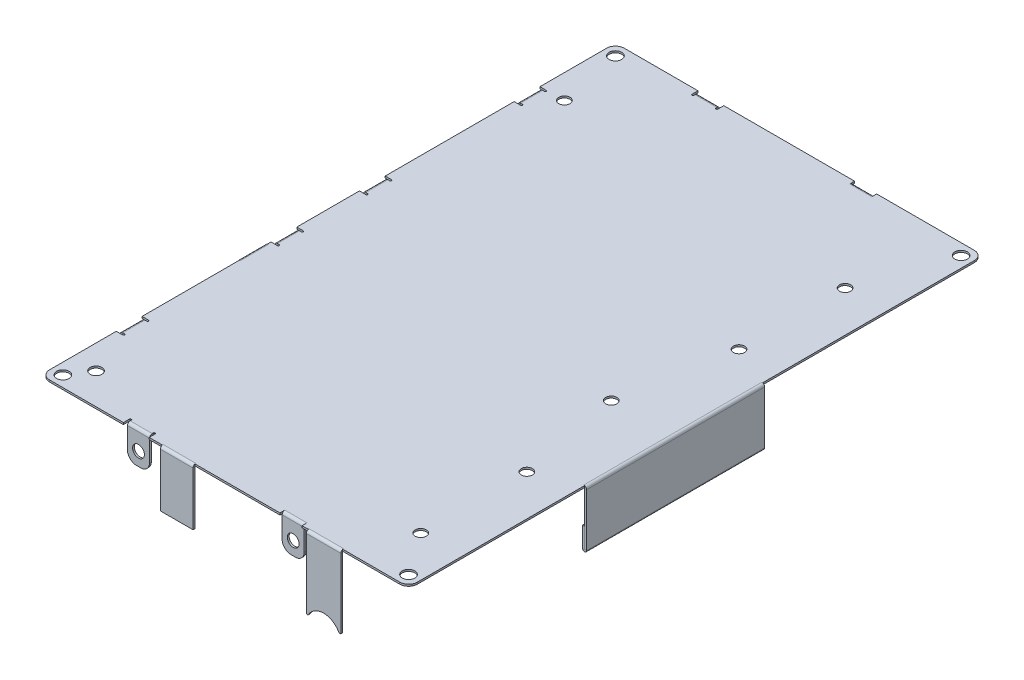
from build123d import *

# Parameters (mm, degrees)
BASE_FLANGE1_DEPTH             = 0.53
EDGE_FLANGE2_STRIP_W           = 3.257999756
EDGE_FLANGE2_STRIP_H           = 0.53
EDGE_FLANGE2_STRIP_CUT_DEPTH   = 6.35
EDGE_FLANGE2_RELIEF_W          = 3.787999756
EDGE_FLANGE2_RELIEF_H          = 0.53
EDGE_FLANGE2_RELIEF_CUT_DEPTH  = 0.53
EDGE_FLANGE2_DEPTH             = 6.35
EDGE_FLANGE2_FLAT_DEPTH        = 0.53
EDGE_FLANGE7_STRIP_W           = 3.258000001
EDGE_FLANGE7_STRIP_H           = 0.53
EDGE_FLANGE7_STRIP_CUT_DEPTH   = 6.35
EDGE_FLANGE7_DEPTH             = 6.35
EDGE_FLANGE7_FLAT_DEPTH        = 0.53
EDGE_FLANGE4_START             = -0.53
EDGE_FLANGE4_OUTLINE_W         = 7.41
EDGE_FLANGE4_OUTLINE_H         = 0.53
EDGE_FLANGE4_DEPTH             = 1.53
EDGE_FLANGE4_START_2           = -1.844
EDGE_FLANGE4_2_OUTLINE_W       = 0.53
EDGE_FLANGE4_2_OUTLINE_H       = 0.53
EDGE_FLANGE4_2_DEPTH           = 1.314
EDGE_FLANGE4_START_3           = 33.411716927
EDGE_FLANGE4_3_DEPTH           = 1.588283073
EDGE_FLANGE4_START_4           = 27.084923007
EDGE_FLANGE4_4_OUTLINE_W       = 0.53
EDGE_FLANGE4_4_OUTLINE_H       = 6.35
EDGE_FLANGE4_4_DEPTH           = 6.096
EDGE_FLANGE4_START_5           = -27.156
EDGE_FLANGE4_5_DEPTH           = 0.53
EDGE_FLANGE4_START_6           = -66.673203949
EDGE_FLANGE4_6_DEPTH           = 6.35
EDGE_FLANGE4_7_DEPTH           = 6.35
EDGE_FLANGE5_START             = -0.53
EDGE_FLANGE5_OUTLINE_W         = 7.41
EDGE_FLANGE5_OUTLINE_H         = 0.53
EDGE_FLANGE5_DEPTH             = 0.53
EDGE_FLANGE5_START_2           = -1.844
EDGE_FLANGE5_2_OUTLINE_W       = 0.53
EDGE_FLANGE5_2_OUTLINE_H       = 0.53
EDGE_FLANGE5_2_DEPTH           = 1.314
EDGE_FLANGE5_START_3           = -22.223203949
EDGE_FLANGE5_3_DEPTH           = 6.35
EDGE_FLANGE5_4_DEPTH           = 6.35
EDGE_FLANGE5_START_4           = 26.366388699
EDGE_FLANGE5_5_DEPTH           = 8.633611301
EDGE_FLANGE5_START_5           = -27.156
EDGE_FLANGE5_6_DEPTH           = 0.53
M3_CLEARANCE_HOLE2_D           = 3.4
M3_CLEARANCE_HOLE2_ON_FACE_2_D = 3.4
M3_CLEARANCE_HOLE2_ON_FACE_3_D = 3.4
M3_CLEARANCE_HOLE1_D           = 3.6
EDGE_FLANGE6_STRIP_W           = 2.628
EDGE_FLANGE6_STRIP_H           = 0.53
EDGE_FLANGE6_STRIP_CUT_DEPTH   = 51.181
EDGE_FLANGE6_DEPTH             = 51.181
HEM1_START                     = -95.438703949
HEM1_DEPTH                     = 51.181
HEM1_2_DEPTH                   = 51.181
EDGE_FLANGE8_STRIP_W           = 2.628
EDGE_FLANGE8_STRIP_H           = 0.53
EDGE_FLANGE8_STRIP_CUT_DEPTH   = 9.906
EDGE_FLANGE8_DEPTH             = 9.906
EDGE_FLANGE8_START             = 0.53
EDGE_FLANGE8_FLAT_DEPTH        = 0.53
EDGE_FLANGE9_STRIP_W           = 2.628
EDGE_FLANGE9_STRIP_H           = 0.53
EDGE_FLANGE9_STRIP_CUT_DEPTH   = 9.398
EDGE_FLANGE9_DEPTH             = 9.398
EDGE_FLANGE10_STRIP_W          = 2.628
EDGE_FLANGE10_STRIP_H          = 0.53
EDGE_FLANGE10_STRIP_CUT_DEPTH  = 8.0645
EDGE_FLANGE10_DEPTH            = 8.0645
SKETCH43_R                     = 1.6
SKETCH43_R_2                   = 1.703104565
CUT_EXTRUDE1_DEPTH             = 2.54


with BuildPart() as part:
    # Base-Flange1: sheet metal written as solids
    # Sketch1 → Base-Flange1 (new body)
    with BuildSketch(Plane(origin=(0, 33.434923007, 0), x_dir=(1, 0, 0), z_dir=(0, 1, 0))):
        with BuildLine():
            Line((-25.146, -6.350000017), (25.146, -6.350000017))
            Line((25.146, -6.350000017), (25.146, 76.198203949))
            Line((25.146, 76.198203949), (-27.686, 76.198203949))
            Line((-27.686, 76.198203949), (-27.686, -3.810000017))
            ThreePointArc((-27.686, -3.810000017), (-26.942051224, -5.606051241), (-25.146, -6.350000017))
        make_face()
    extrude(amount=BASE_FLANGE1_DEPTH)

    # Mirror2: part across plane


with BuildPart() as part_1:
    add(part.part)
    add(part.part.mirror(Plane(origin=(25.146, 33.964923007, 6.350000017), x_dir=(0, 0, 1), z_dir=(-1, 0, 0))))

    # Edge-Flange2: sheet metal written as solids
    # Edge-Flange2 strip (on a plane across the edge) → Edge-Flange2 strip cut (cut)
    with BuildSketch(Plane(origin=(2.921, 33.434923007, 5.720000261), x_dir=(0, 0, -1), z_dir=(-1, 0, 0))):
        with Locations((-0.844999878, -0.265)):
            Rectangle(EDGE_FLANGE2_STRIP_W, EDGE_FLANGE2_STRIP_H)
    extrude(amount=EDGE_FLANGE2_STRIP_CUT_DEPTH, mode=Mode.SUBTRACT)

    # Edge-Flange2 relief (on the sheet) → Edge-Flange2 relief cut (cut)
    with BuildSketch(Plane(origin=(2.921, 33.434923007, 4.936000261), x_dir=(0, 0, -1), z_dir=(0, -1, 0))):
        with Locations((-1.363999878, 0.265)):
            Rectangle(EDGE_FLANGE2_RELIEF_W, EDGE_FLANGE2_RELIEF_H)
        with Locations((-1.363999878, -6.615)):
            Rectangle(EDGE_FLANGE2_RELIEF_W, EDGE_FLANGE2_RELIEF_H)
    extrude(amount=-EDGE_FLANGE2_RELIEF_CUT_DEPTH, mode=Mode.SUBTRACT)

    # Edge-Flange2 bend section (on a plane across the edge) → Edge-Flange2 (add)
    with BuildSketch(Plane(origin=(2.921, 33.434923007, 5.720000261), x_dir=(0, 0, -1), z_dir=(-1, 0, 0))):
        with BuildLine():
            Line((0, 0.254), (0.53, 0.254))
            ThreePointArc((0.53, 0.254), (0.604394878, 0.074394878), (0.784, 0))
            Line((0.784, 0), (0.784, -0.53))
            ThreePointArc((0.784, -0.53), (0.229628284, -0.300371716), (0, 0.254))
        make_face()
    extrude(amount=EDGE_FLANGE2_DEPTH)

    # Edge-Flange2 profile (on flange) → Edge-Flange2 flat (add)
    with BuildSketch(Plane(origin=(0, 33.434923007, 5.720000261), x_dir=(-1, 0, 0), z_dir=(0, 0, 1))):
        with BuildLine():
            ThreePointArc((3.429, 6.35), (2.685051224, 8.146051224), (0.889, 8.89))
            Line((0.889, 8.89), (-0.381, 8.89))
            ThreePointArc((-0.381, 8.89), (-2.177051224, 8.146051224), (-2.921, 6.35))
            Line((-2.921, 6.35), (-2.921, 0.254))
            Line((-2.921, 0.254), (3.429, 0.254))
            Line((3.429, 0.254), (3.429, 6.35))
        make_face()
    extrude(amount=-EDGE_FLANGE2_FLAT_DEPTH)

    # Edge-Flange7: sheet metal written as solids
    # Edge-Flange7 strip (on a plane across the edge) → Edge-Flange7 strip cut (cut)
    with BuildSketch(Plane(origin=(47.371, 33.434923007, 5.720000017), x_dir=(0, 0, -1), z_dir=(-1, 0, 0))):
        with Locations((-0.845000001, -0.265)):
            Rectangle(EDGE_FLANGE7_STRIP_W, EDGE_FLANGE7_STRIP_H)
    extrude(amount=EDGE_FLANGE7_STRIP_CUT_DEPTH, mode=Mode.SUBTRACT)

    # Edge-Flange7 bend section (on a plane across the edge) → Edge-Flange7 (add)
    with BuildSketch(Plane(origin=(47.371, 33.434923007, 5.720000017), x_dir=(0, 0, -1), z_dir=(-1, 0, 0))):
        with BuildLine():
            Line((0, 0.254), (0.53, 0.254))
            ThreePointArc((0.53, 0.254), (0.604394878, 0.074394878), (0.784, 0))
            Line((0.784, 0), (0.784, -0.53))
            ThreePointArc((0.784, -0.53), (0.229628284, -0.300371716), (0, 0.254))
        make_face()
    extrude(amount=EDGE_FLANGE7_DEPTH)

    # Edge-Flange7 profile (on flange) → Edge-Flange7 flat (add)
    with BuildSketch(Plane(origin=(0, 33.434923007, 5.720000017), x_dir=(-1, 0, 0), z_dir=(0, 0, 1))):
        with BuildLine():
            Line((-41.021, 0.254), (-41.021, 6.35))
            ThreePointArc((-41.021, 6.35), (-41.764948776, 8.146051224), (-43.561, 8.89))
            Line((-43.561, 8.89), (-44.831, 8.89))
            ThreePointArc((-44.831, 8.89), (-46.627051224, 8.146051224), (-47.371, 6.35))
            Line((-47.371, 6.35), (-47.371, 0.254))
            Line((-47.371, 0.254), (-41.021, 0.254))
        make_face()
    extrude(amount=-EDGE_FLANGE7_FLAT_DEPTH)

    # Edge-Flange4: read off the stored shape, not the designer's step
    # Edge-Flange4 outline → Edge-Flange4 (cut)
    with BuildSketch(Plane(origin=(-27.686, 33.434923007, 0), x_dir=(0, 0, -1), z_dir=(-1, 0, 0)).offset(EDGE_FLANGE4_START)):
        with Locations((63.498203949, -0.265)):
            Rectangle(EDGE_FLANGE4_OUTLINE_W, EDGE_FLANGE4_OUTLINE_H)
    extrude(amount=EDGE_FLANGE4_DEPTH, mode=Mode.SUBTRACT)

    # Edge-Flange4 2 outline → Edge-Flange4 2 (cut)
    with BuildSketch(Plane(origin=(-27.686, 33.434923007, 0), x_dir=(0, 0, -1), z_dir=(-1, 0, 0)).offset(EDGE_FLANGE4_START_2)):
        with Locations((60.058203949, -0.265)):
            Rectangle(EDGE_FLANGE4_2_OUTLINE_W, EDGE_FLANGE4_2_OUTLINE_H)
        with Locations((66.938203949, -0.265)):
            Rectangle(EDGE_FLANGE4_2_OUTLINE_W, EDGE_FLANGE4_2_OUTLINE_H)
    extrude(amount=EDGE_FLANGE4_2_DEPTH, mode=Mode.SUBTRACT)

    # Edge-Flange4 3 outline → Edge-Flange4 3 (cut)
    with BuildSketch(Plane(origin=(0, 0, 0), x_dir=(1, 0, 0), z_dir=(0, 1, 0)).offset(EDGE_FLANGE4_START_3)):
        with BuildLine():
            Line((-25.842, 67.203203949), (-25.842, 66.673203949))
            ThreePointArc((-25.842, 66.673203949), (-25.577, 66.938203949), (-25.842, 67.203203949))
        make_face()
        with BuildLine():
            ThreePointArc((-25.842, 59.793203949), (-25.577, 60.058203949), (-25.842, 60.323203949))
            Line((-25.842, 60.323203949), (-25.842, 59.793203949))
        make_face()
    extrude(amount=EDGE_FLANGE4_3_DEPTH, mode=Mode.SUBTRACT)



with BuildPart() as body_2:
    # Edge-Flange4 4 outline → Edge-Flange4 4 (new body)
    with BuildSketch(Plane(origin=(0, 0, 0), x_dir=(1, 0, 0), z_dir=(0, 1, 0)).offset(EDGE_FLANGE4_START_4)):
        with Locations((-26.891, 63.498203949)):
            Rectangle(EDGE_FLANGE4_4_OUTLINE_W, EDGE_FLANGE4_4_OUTLINE_H)
    extrude(amount=EDGE_FLANGE4_4_DEPTH)

    # Edge-Flange4 5 outline → Edge-Flange4 5 (add)
    with BuildSketch(Plane.YZ.offset(EDGE_FLANGE4_START_5)):
        with BuildLine():
            Line((24.544923007, -62.863203949), (24.544923007, -64.133203949))
            ThreePointArc((24.544923007, -64.133203949), (25.288871783, -65.929255173), (27.084923007, -66.673203949))
            Line((27.084923007, -66.673203949), (27.084923007, -60.323203949))
            ThreePointArc((27.084923007, -60.323203949), (25.288871783, -61.067152725), (24.544923007, -62.863203949))
        make_face()
    extrude(amount=EDGE_FLANGE4_5_DEPTH)


with BuildPart() as part_2:
    add(part_1.part)

    add(body_2.part)  # Edge-Flange4 6 merges body 2
    # Edge-Flange4 6 outline → Edge-Flange4 6 (add)
    with BuildSketch(Plane.XY.offset(EDGE_FLANGE4_START_6)):
        with BuildLine():
            ThreePointArc((-27.11371423, 33.434923007), (-27.145356307, 33.309670906), (-27.156, 33.180923007))
            Line((-27.156, 33.180923007), (-26.626, 33.180923007))
            ThreePointArc((-26.626, 33.180923007), (-26.551605122, 33.360528129), (-26.372, 33.434923007))
            Line((-26.372, 33.434923007), (-27.11371423, 33.434923007))
        make_face()
    extrude(amount=EDGE_FLANGE4_6_DEPTH)

    # Edge-Flange4 7 outline → Edge-Flange4 7 (cut)
    with BuildSketch(Plane.XY.offset(EDGE_FLANGE4_START_6)):
        with BuildLine():
            Line((-27.156, 33.434923007), (-27.11371423, 33.434923007))
            ThreePointArc((-27.11371423, 33.434923007), (-26.827806976, 33.818807009), (-26.372, 33.964923007))
            Line((-26.372, 33.964923007), (-27.156, 33.964923007))
            Line((-27.156, 33.964923007), (-27.156, 33.434923007))
        make_face()
    extrude(amount=EDGE_FLANGE4_7_DEPTH, mode=Mode.SUBTRACT)

    # Edge-Flange5: read off the stored shape, not the designer's step
    # Edge-Flange5 outline → Edge-Flange5 (cut)
    with BuildSketch(Plane(origin=(-27.686, 33.434923007, 0), x_dir=(0, 0, -1), z_dir=(-1, 0, 0)).offset(EDGE_FLANGE5_START)):
        with Locations((19.048203949, -0.265)):
            Rectangle(EDGE_FLANGE5_OUTLINE_W, EDGE_FLANGE5_OUTLINE_H)
    extrude(amount=EDGE_FLANGE5_DEPTH, mode=Mode.SUBTRACT)

    # Edge-Flange5 2 outline → Edge-Flange5 2 (cut)
    with BuildSketch(Plane(origin=(-27.686, 33.434923007, 0), x_dir=(0, 0, -1), z_dir=(-1, 0, 0)).offset(EDGE_FLANGE5_START_2)):
        with Locations((15.608203949, -0.265)):
            Rectangle(EDGE_FLANGE5_2_OUTLINE_W, EDGE_FLANGE5_2_OUTLINE_H)
        with Locations((22.488203949, -0.265)):
            Rectangle(EDGE_FLANGE5_2_OUTLINE_W, EDGE_FLANGE5_2_OUTLINE_H)
    extrude(amount=EDGE_FLANGE5_2_DEPTH, mode=Mode.SUBTRACT)

    # Edge-Flange5 3 outline → Edge-Flange5 3 (cut)
    with BuildSketch(Plane.XY.offset(EDGE_FLANGE5_START_3)):
        with BuildLine():
            Line((-27.156, 33.434923007), (-27.11371423, 33.434923007))
            ThreePointArc((-27.11371423, 33.434923007), (-26.827806976, 33.818807009), (-26.372, 33.964923007))
            Line((-26.372, 33.964923007), (-27.156, 33.964923007))
            Line((-27.156, 33.964923007), (-27.156, 33.434923007))
        make_face()
    extrude(amount=EDGE_FLANGE5_3_DEPTH, mode=Mode.SUBTRACT)

    # Edge-Flange5 4 outline → Edge-Flange5 4 (add)
    with BuildSketch(Plane.XY.offset(EDGE_FLANGE5_START_3)):
        with BuildLine():
            Line((-27.156, 24.544923007), (-26.626, 24.544923007))
            Line((-26.626, 24.544923007), (-26.626, 33.180923007))
            ThreePointArc((-26.626, 33.180923007), (-26.551605122, 33.360528129), (-26.372, 33.434923007))
            Line((-26.372, 33.434923007), (-27.11371423, 33.434923007))
            ThreePointArc((-27.11371423, 33.434923007), (-27.145356307, 33.309670906), (-27.156, 33.180923007))
            Line((-27.156, 33.180923007), (-27.156, 24.544923007))
        make_face()
    extrude(amount=EDGE_FLANGE5_4_DEPTH)

    # Edge-Flange5 5 outline → Edge-Flange5 5 (cut)
    with BuildSketch(Plane(origin=(0, 0, 0), x_dir=(1, 0, 0), z_dir=(0, 1, 0)).offset(EDGE_FLANGE5_START_4)):
        with BuildLine():
            Line((-25.842, 22.753203949), (-25.842, 22.223203949))
            ThreePointArc((-25.842, 22.223203949), (-25.577, 22.488203949), (-25.842, 22.753203949))
        make_face()
        with BuildLine():
            Line((-25.842, 15.873203949), (-25.842, 15.343203949))
            ThreePointArc((-25.842, 15.343203949), (-25.577, 15.608203949), (-25.842, 15.873203949))
        make_face()
    extrude(amount=EDGE_FLANGE5_5_DEPTH, mode=Mode.SUBTRACT)

    # Edge-Flange5 6 outline → Edge-Flange5 6 (cut)
    with BuildSketch(Plane.YZ.offset(EDGE_FLANGE5_START_5)):
        with BuildLine():
            ThreePointArc((27.084923007, -22.223203949), (25.288871783, -21.479255173), (24.544923007, -19.683203949))
            Line((24.544923007, -19.683203949), (24.544923007, -22.223203949))
            Line((24.544923007, -22.223203949), (27.084923007, -22.223203949))
        make_face()
        with BuildLine():
            Line((24.544923007, -15.873203949), (24.544923007, -18.413203949))
            ThreePointArc((24.544923007, -18.413203949), (25.288871783, -16.617152725), (27.084923007, -15.873203949))
            Line((27.084923007, -15.873203949), (24.544923007, -15.873203949))
        make_face()
    extrude(amount=EDGE_FLANGE5_6_DEPTH, mode=Mode.SUBTRACT)

    # M3 Clearance Hole2 (through all)
    with Locations(Plane(origin=(-26.626, 28.354923007, -63.498203949), x_dir=(0, 1, 0), z_dir=(1, 0, 0))):
        with Locations((0, 0), (0, 44.45)):
            Hole(M3_CLEARANCE_HOLE2_D / 2)

    # M3 Clearance Hole2 on face 2 (through all)
    with Locations(Plane(origin=(-0.254, 28.354923007, 5.190000261), x_dir=(-1, 0, 0), z_dir=(0, 0, -1))):
        with Locations((0, 0)):
            Hole(M3_CLEARANCE_HOLE2_ON_FACE_2_D / 2)

    # M3 Clearance Hole2 on face 3 (through all)
    with Locations(Plane(origin=(44.196, 28.354923007, 5.720000017), x_dir=(1, 0, 0), z_dir=(0, 0, 1))):
        with Locations((0, 0)):
            Hole(M3_CLEARANCE_HOLE2_ON_FACE_3_D / 2)

    # M3 Clearance Hole1 (through all)
    with Locations(Plane(origin=(0, 33.964923007, 0), x_dir=(1, 0, 0), z_dir=(0, 1, 0))):
        with Locations((-24.511, -3.176796068), (74.803, -3.176796068)):
            Hole(M3_CLEARANCE_HOLE1_D / 2)

    # Mirror1: part across face


with BuildPart() as part_3:
    add(part_2.part)
    add(part_2.part.mirror(Plane(origin=(25.146, 33.699923007, -76.198203949), x_dir=(1, 0, 0), z_dir=(0, 0, -1))))

    # Edge-Flange6: sheet metal written as solids
    # Edge-Flange6 strip (on a plane across the edge) → Edge-Flange6 strip cut (cut)
    with BuildSketch(Plane(origin=(77.978, 33.434923007, -95.438703949), x_dir=(-1, 0, 0), z_dir=(0, 0, 1))):
        with Locations((-1.06, -0.265)):
            Rectangle(EDGE_FLANGE6_STRIP_W, EDGE_FLANGE6_STRIP_H)
    extrude(amount=EDGE_FLANGE6_STRIP_CUT_DEPTH, mode=Mode.SUBTRACT)

    # Edge-Flange6 section (on a plane across the edge) → Edge-Flange6 (add)
    with BuildSketch(Plane(origin=(77.978, 33.434923007, -95.438703949), x_dir=(-1, 0, 0), z_dir=(0, 0, 1))):
        with BuildLine():
            Line((-0.53, 0.254), (-0.53, 16.002))
            Line((-0.53, 16.002), (0, 16.002))
            Line((0, 16.002), (0, 0.254))
            ThreePointArc((0, 0.254), (0.074394878, 0.074394878), (0.254, 0))
            Line((0.254, 0), (0.254, -0.53))
            ThreePointArc((0.254, -0.53), (-0.300371716, -0.300371716), (-0.53, 0.254))
        make_face()
    extrude(amount=EDGE_FLANGE6_DEPTH)

    # Hem1: read off the stored shape, not the designer's step
    # Hem1 outline → Hem1 (cut)
    with BuildSketch(Plane.XY.offset(HEM1_START)):
        with BuildLine():
            ThreePointArc((78.508, 18.012923007), (78.355434205, 17.620877091), (77.978, 17.435082198))
            Line((77.978, 17.435082198), (77.978, 17.432923007))
            Line((77.978, 17.432923007), (78.508, 17.432923007))
            Line((78.508, 17.432923007), (78.508, 18.012923007))
        make_face()
    extrude(amount=HEM1_DEPTH, mode=Mode.SUBTRACT)

    # Hem1 2 outline → Hem1 2 (add)
    with BuildSketch(Plane.XY.offset(HEM1_START)):
        with BuildLine():
            Line((77.878, 23.782923007), (77.348, 23.782923007))
            Line((77.348, 23.782923007), (77.348, 18.012923007))
            ThreePointArc((77.348, 18.012923007), (77.535954084, 17.585488802), (77.978, 17.435082198))
            Line((77.978, 17.435082198), (77.978, 18.012923007))
            ThreePointArc((77.978, 18.012923007), (77.928, 17.962923007), (77.878, 18.012923007))
            Line((77.878, 18.012923007), (77.878, 23.782923007))
        make_face()
    extrude(amount=HEM1_2_DEPTH)

    # Edge-Flange8: sheet metal written as solids
    # Edge-Flange8 strip (on a plane across the edge) → Edge-Flange8 strip cut (cut)
    with BuildSketch(Plane(origin=(59.045498, 33.434923007, 6.350000017), x_dir=(0, 0, -1), z_dir=(-1, 0, 0))):
        with Locations((-1.06, -0.265)):
            Rectangle(EDGE_FLANGE8_STRIP_W, EDGE_FLANGE8_STRIP_H)
    extrude(amount=EDGE_FLANGE8_STRIP_CUT_DEPTH, mode=Mode.SUBTRACT)

    # Edge-Flange8 bend section (on a plane across the edge) → Edge-Flange8 (add)
    with BuildSketch(Plane(origin=(59.045498, 33.434923007, 6.350000017), x_dir=(0, 0, -1), z_dir=(-1, 0, 0))):
        with BuildLine():
            Line((-0.53, 0.254), (0, 0.254))
            ThreePointArc((0, 0.254), (0.074394878, 0.074394878), (0.254, 0))
            Line((0.254, 0), (0.254, -0.53))
            ThreePointArc((0.254, -0.53), (-0.300371716, -0.300371716), (-0.53, 0.254))
        make_face()
    extrude(amount=EDGE_FLANGE8_DEPTH)

    # Edge-Flange8 profile (on flange) → Edge-Flange8 flat (add)
    with BuildSketch(Plane(origin=(0, 33.434923007, 6.350000017), x_dir=(-1, 0, 0), z_dir=(0, 0, 1)).offset(EDGE_FLANGE8_START)):
        with BuildLine():
            Line((-59.045498, 0.254), (-49.139498, 0.254))
            Line((-49.139498, 0.254), (-49.139498, 20.292))
            Line((-49.139498, 20.292), (-49.665172566, 20.292))
            ThreePointArc((-49.665172566, 20.292), (-54.092498, 17.595329381), (-58.519823434, 20.292))
            Line((-58.519823434, 20.292), (-59.045498, 20.292))
            Line((-59.045498, 20.292), (-59.045498, 0.254))
        make_face()
    extrude(amount=-EDGE_FLANGE8_FLAT_DEPTH)

    # Edge-Flange9: sheet metal written as solids
    # Edge-Flange9 strip (on a plane across the edge) → Edge-Flange9 strip cut (cut)
    with BuildSketch(Plane(origin=(16.5862, 33.434923007, 6.350000017), x_dir=(0, 0, -1), z_dir=(-1, 0, 0))):
        with Locations((-1.06, -0.265)):
            Rectangle(EDGE_FLANGE9_STRIP_W, EDGE_FLANGE9_STRIP_H)
    extrude(amount=EDGE_FLANGE9_STRIP_CUT_DEPTH, mode=Mode.SUBTRACT)

    # Edge-Flange9 section (on a plane across the edge) → Edge-Flange9 (add)
    with BuildSketch(Plane(origin=(16.5862, 33.434923007, 6.350000017), x_dir=(0, 0, -1), z_dir=(-1, 0, 0))):
        with BuildLine():
            Line((-0.53, 0.254), (-0.53, 15.621))
            Line((-0.53, 15.621), (0, 15.621))
            Line((0, 15.621), (0, 0.254))
            ThreePointArc((0, 0.254), (0.074394878, 0.074394878), (0.254, 0))
            Line((0.254, 0), (0.254, -0.53))
            ThreePointArc((0.254, -0.53), (-0.300371716, -0.300371716), (-0.53, 0.254))
        make_face()
    extrude(amount=EDGE_FLANGE9_DEPTH)

    # Edge-Flange10: sheet metal written as solids
    # Edge-Flange10 strip (on a plane across the edge) → Edge-Flange10 strip cut (cut)
    with BuildSketch(Plane(origin=(-27.686, 33.434923007, -50.829953949), x_dir=(1, 0, 0), z_dir=(0, 0, -1))):
        with Locations((-1.06, -0.265)):
            Rectangle(EDGE_FLANGE10_STRIP_W, EDGE_FLANGE10_STRIP_H)
    extrude(amount=EDGE_FLANGE10_STRIP_CUT_DEPTH, mode=Mode.SUBTRACT)

    # Edge-Flange10 section (on a plane across the edge) → Edge-Flange10 (add)
    with BuildSketch(Plane(origin=(-27.686, 33.434923007, -50.829953949), x_dir=(1, 0, 0), z_dir=(0, 0, -1))):
        with BuildLine():
            Line((-0.53, 0.254), (-0.53, 15.621))
            Line((-0.53, 15.621), (0, 15.621))
            Line((0, 15.621), (0, 0.254))
            ThreePointArc((0, 0.254), (0.074394878, 0.074394878), (0.254, 0))
            Line((0.254, 0), (0.254, -0.53))
            ThreePointArc((0.254, -0.53), (-0.300371716, -0.300371716), (-0.53, 0.254))
        make_face()
    extrude(amount=EDGE_FLANGE10_DEPTH)

    # Sketch43 → Cut-Extrude1 (cut)
    with BuildSketch(Plane(origin=(0, 33.964923007, 0), x_dir=(1, 0, 0), z_dir=(0, 1, 0))):
        with Locations(Location((-20.751, 137.151407914, 0), (0, 0, 180))):
            Circle(SKETCH43_R)
        with Locations(Location((66.244, 130.801407914, 0), (0, 0, 180))):
            Circle(SKETCH43_R)
        with Locations(Location((66.244, 100.321407914, 0), (0, 0, 180))):
            Circle(SKETCH43_R)
        with Locations(Location((60.656, 69.206407914, 0), (0, 0, 180))):
            Circle(SKETCH43_R)
        with Locations(Location((66.244, 39.361407914, 0), (0, 0, 180))):
            Circle(SKETCH43_R)
        with Locations(Location((66.244, 8.881407914, 0), (0, 0, 180))):
            Circle(SKETCH43_R)
        with Locations(Location((-20.751, 2.594628137, 0), (0, 0, 180))):
            Circle(SKETCH43_R_2)
    extrude(amount=-CUT_EXTRUDE1_DEPTH, mode=Mode.SUBTRACT)


solid = part_3.part
